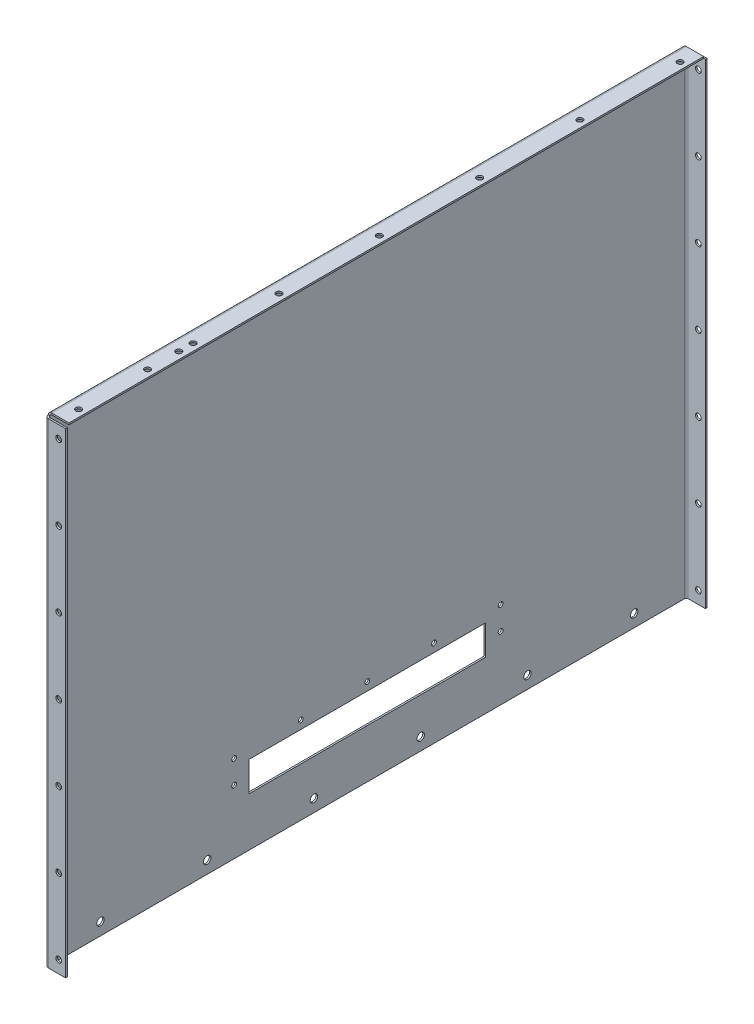
from build123d import *

# Parameters (mm, degrees)
BASE_FLANGE1_DEPTH       = 574.9
EDGE_FLANGE1_DEPTH       = 767
M8_CLEARANCE_HOLE1_D     = 9
LPATTERN1_COUNT          = 6
LPATTERN1_PITCH          = 129
F_7_0_7_DIAMETER_HOLE1_D = 7
F_7_0_7_DIAMETER_HOLE2_D = 7
F_7_0_7_DIAMETER_HOLE3_D = 7
SKETCH17_W               = 286
SKETCH17_H               = 36
CUT_EXTRUDE1_DEPTH       = 2
M5_CLEARANCE_HOLE1_D     = 5.8
FILLET1_R                = 1


# Sheet-metal steps are written as plain solids
with BuildPart() as part:
    # Sketch1 → Base-Flange1 (new body)
    with BuildSketch(Plane(origin=(0, 0, 0), x_dir=(1, 0, 0), z_dir=(0, 1, 0))):
        with BuildLine():
            Line((25, 387.5), (4, 387.5))
            ThreePointArc((4, 387.5), (1.171572875, 386.328427125), (0, 383.5))
            Line((0, 383.5), (0, -383.5))
            ThreePointArc((0, -383.5), (1.171572875, -386.328427125), (4, -387.5))
            Line((4, -387.5), (25, -387.5))
            Line((25, -387.5), (25, -385.5))
            Line((25, -385.5), (4, -385.5))
            ThreePointArc((4, -385.5), (2.585786438, -384.914213562), (2, -383.5))
            Line((2, -383.5), (2, 383.5))
            ThreePointArc((2, 383.5), (2.585786438, 384.914213562), (4, 385.5))
            Line((4, 385.5), (25, 385.5))
            Line((25, 385.5), (25, 387.5))
        make_face()
    extrude(amount=BASE_FLANGE1_DEPTH)

    # Edge-Flange1 section (across the edge) → Edge-Flange1 (add)
    with BuildSketch(Plane(origin=(2, 576.9, -383.5), x_dir=(0, -1, 0), z_dir=(0, 0, 1))):
        with BuildLine():
            Line((-2, 2), (-2, 23))
            Line((-2, 23), (0, 23))
            Line((0, 23), (0, 2))
            ThreePointArc((0, 2), (0.585786438, 0.585786438), (2, 0))
            Line((2, 0), (2, -2))
            ThreePointArc((2, -2), (-0.828427125, -0.828427125), (-2, 2))
        make_face()
    extrude(amount=EDGE_FLANGE1_DEPTH)

    # M8 Clearance Hole1 (through all)
    with Locations(Plane(origin=(2, 0, 0), x_dir=(0, 0, -1), z_dir=(1, 0, 0))):
        with Locations((322.5, 15)):
            m8_clearance_hole1 = Hole(M8_CLEARANCE_HOLE1_D / 2)

    # LPattern1: M8 Clearance Hole1 ×6
    with Locations(*[(0, 0, i * LPATTERN1_PITCH) for i in range(1, LPATTERN1_COUNT)]):
        add(m8_clearance_hole1, mode=Mode.SUBTRACT)

    # Ø7.0 (7) Diameter Hole1 (through all)
    with Locations(Plane(origin=(0, 0, -387.5), x_dir=(-1, 0, 0), z_dir=(0, 0, -1))):
        with Locations((-16.5, 559.9), (-16.5, 469.083333333), (-16.5, 378.266666667), (-16.5, 287.45), (-16.5, 196.633333333), (-16.5, 105.816666667), (-16.5, 15)):
            Hole(F_7_0_7_DIAMETER_HOLE1_D / 2)

    # Ø7.0 (7) Diameter Hole2 (through all)
    with Locations(Plane(origin=(0, 576.9, 0), x_dir=(-1, 0, 0), z_dir=(0, -1, 0))):
        with Locations((-16.5, 363.5), (-16.5, 242.333333333), (-16.5, 121.166666667), (-16.5, 0), (-16.5, -121.166666667), (-16.5, -242.333333333), (-16.5, -363.5)):
            Hole(F_7_0_7_DIAMETER_HOLE2_D / 2)

    # Ø7.0 (7) Diameter Hole3 (through all)
    with Locations(Plane(origin=(0, 578.9, 0), x_dir=(1, 0, 0), z_dir=(0, 1, 0))):
        with Locations((16.5, -225), (16.5, -280)):
            Hole(F_7_0_7_DIAMETER_HOLE3_D / 2)

    # Sketch17 → Cut-Extrude1 (cut)
    with BuildSketch(Plane(origin=(2, 0, 0), x_dir=(0, 0, -1), z_dir=(1, 0, 0))):
        with Locations((0, 77)):
            Rectangle(SKETCH17_W, SKETCH17_H)
    extrude(amount=-CUT_EXTRUDE1_DEPTH, mode=Mode.SUBTRACT)

    # M5 Clearance Hole1 (through all)
    with Locations(Plane(origin=(2, 0, 0), x_dir=(0, 0, -1), z_dir=(1, 0, 0))):
        with Locations((-161, 77), (-161, 105), (-80.5, 105), (0, 105), (80.5, 105), (161, 105), (161, 77)):
            Hole(M5_CLEARANCE_HOLE1_D / 2)

    # Fillet1
    fillet1_edges = [part.edges().sort_by_distance(p)[0] for p in [
        (1, 59, 143),
        (1, 95, 143),
        (1, 95, -143),
        (1, 59, -143),
    ]]
    fillet(fillet1_edges, radius=FILLET1_R)


solid = part.part
